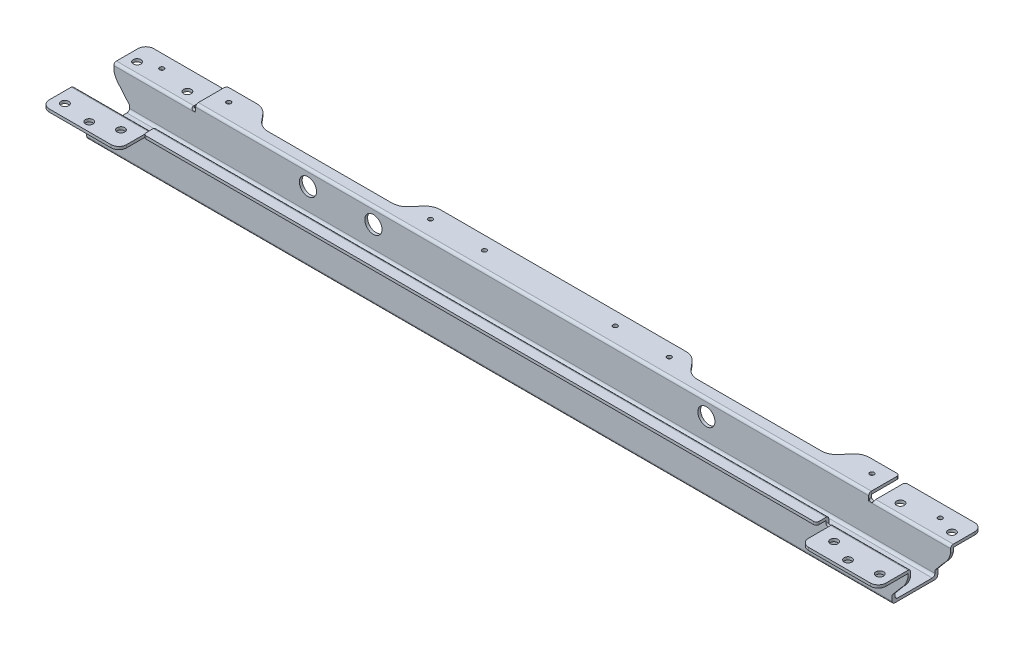
from build123d import *

# Parameters (mm, degrees)
BOSS_EXTRUDE1_DEPTH = 442.65
BOSS_EXTRUDE2_DEPTH = 25.07
SKETCH4_W           = 21.95
SKETCH4_H           = 18.71
CUT_EXTRUDE2_DEPTH  = 461.668386071
SKETCH5_R           = 4.725
CUT_EXTRUDE3_DEPTH  = 1.56
BOSS_EXTRUDE3_DEPTH = 1.56
BOSS_EXTRUDE4_DEPTH = 1.56
FILLET1_R           = 1.44
BOSS_EXTRUDE5_DEPTH = 1.56
FILLET2_R           = 1.44
SKETCH10_R          = 2.115
SKETCH10_R_2        = 1.22
CUT_EXTRUDE4_DEPTH  = 453.665622856
SKETCH11_R          = 1.22
SKETCH11_R_2        = 2.875
SKETCH11_R_3        = 3.865
CUT_EXTRUDE5_DEPTH  = 453.798104364


with BuildPart() as part:
    # Sketch1 → Boss-Extrude1 (new body)
    with BuildSketch(Plane(origin=(0, 0, 0), x_dir=(0, 0, -1), z_dir=(1, 0, 0))):
        with BuildLine():
            Line((-11.095, 0), (11.095, 0))
            ThreePointArc((11.095, 0), (12.113233765, 0.421766235), (12.535, 1.44))
            Line((12.535, 1.44), (12.535, 4.55))
            Line((12.535, 4.55), (10.975, 4.55))
            Line((10.975, 4.55), (10.975, 3))
            ThreePointArc((10.975, 3), (10.553233765, 1.981766235), (9.535, 1.56))
            Line((9.535, 1.56), (-9.535, 1.56))
            ThreePointArc((-9.535, 1.56), (-10.553233765, 1.981766235), (-10.975, 3))
            Line((-10.975, 3), (-10.975, 4.55))
            Line((-10.975, 4.55), (-12.535, 4.55))
            Line((-12.535, 4.55), (-12.535, 1.44))
            ThreePointArc((-12.535, 1.44), (-12.113233765, 0.421766235), (-11.095, 0))
        make_face()
    extrude(amount=-BOSS_EXTRUDE1_DEPTH)

    # Sketch2 → Boss-Extrude2 (add)
    with BuildSketch(Plane(origin=(0, 0, -12.535), x_dir=(-1, 0, 0), z_dir=(0, 0, -1))):
        with BuildLine():
            Line((-8.63, 20.52), (-8.63, 16.92))
            ThreePointArc((-8.63, 16.92), (-7.322682784, 13.416106263), (-4.988031851, 10.494504879))
            Line((-4.988031851, 10.494504879), (0, 4.55))
            Line((0, 4.55), (442.65, 4.55))
            Line((442.65, 4.55), (447.638031851, 10.494504879))
            ThreePointArc((447.638031851, 10.494504879), (449.972682784, 13.416106263), (451.28, 16.92))
            Line((451.28, 16.92), (451.28, 20.52))
            Line((451.28, 20.52), (442.65, 20.52))
            Line((442.65, 20.52), (408.71, 20.52))
            ThreePointArc((408.71, 20.52), (407.49, 19.3), (406.27, 20.52))
            Line((406.27, 20.52), (406.27, 23.26))
            Line((406.27, 23.26), (36.38, 23.26))
            Line((36.38, 23.26), (36.38, 20.52))
            ThreePointArc((36.38, 20.52), (35.16, 19.3), (33.94, 20.52))
            Line((33.94, 20.52), (0, 20.52))
            Line((0, 20.52), (-8.63, 20.52))
        make_face()
    extrude(amount=-BOSS_EXTRUDE2_DEPTH)

    # Sketch4 → Cut-Extrude2 (cut, through all)
    with BuildSketch(Plane.ZY.offset(451.28)):
        with Locations((0, 13.905)):
            Rectangle(SKETCH4_W, SKETCH4_H)
    extrude(amount=-CUT_EXTRUDE2_DEPTH, mode=Mode.SUBTRACT)

    # Sketch5 → Cut-Extrude3 (cut)
    with BuildSketch(Plane(origin=(0, 0, -12.535), x_dir=(-1, 0, 0), z_dir=(0, 0, -1))):
        with Locations((344.595, 14.795)):
            Circle(SKETCH5_R)
        with Locations((308.625, 14.795)):
            Circle(SKETCH5_R)
        with Locations((125.615, 14.795)):
            Circle(SKETCH5_R)
    extrude(amount=-CUT_EXTRUDE3_DEPTH, mode=Mode.SUBTRACT)

    # Sketch7 → Boss-Extrude3 (add)
    with BuildSketch(Plane(origin=(0, 20.52, 0), x_dir=(1, 0, 0), z_dir=(0, 1, 0))):
        with BuildLine():
            Line((-451.28, 12.535), (-408.71, 12.535))
            Line((-408.71, 12.535), (-408.71, 27.125))
            ThreePointArc((-408.71, 27.125), (-409.131766235, 28.143233765), (-410.15, 28.565))
            Line((-410.15, 28.565), (-446.96, 28.565))
            ThreePointArc((-446.96, 28.565), (-450.014701295, 27.299701295), (-451.28, 24.245))
            Line((-451.28, 24.245), (-451.28, 12.535))
        make_face()
        with BuildLine():
            Line((-33.94, 12.535), (-33.94, 27.125))
            ThreePointArc((-33.94, 27.125), (-33.518233765, 28.143233765), (-32.5, 28.565))
            Line((-32.5, 28.565), (4.31, 28.565))
            ThreePointArc((4.31, 28.565), (7.364701295, 27.299701295), (8.63, 24.245))
            Line((8.63, 24.245), (8.63, 12.535))
            Line((8.63, 12.535), (-33.94, 12.535))
        make_face()
    extrude(amount=-BOSS_EXTRUDE3_DEPTH)

    # Sketch8 → Boss-Extrude4 (add)
    with BuildSketch(Plane(origin=(0, 20.52, 0), x_dir=(1, 0, 0), z_dir=(0, 1, 0))):
        with BuildLine():
            Line((-33.94, -12.535), (8.63, -12.535))
            Line((8.63, -12.535), (8.63, -24.515))
            ThreePointArc((8.63, -24.515), (7.364701295, -27.569701295), (4.31, -28.835))
            Line((4.31, -28.835), (-29.62, -28.835))
            ThreePointArc((-29.62, -28.835), (-32.674701295, -27.569701295), (-33.94, -24.515))
            Line((-33.94, -24.515), (-33.94, -12.535))
        make_face()
        with BuildLine():
            Line((-408.71, -12.535), (-408.71, -24.515))
            ThreePointArc((-408.71, -24.515), (-409.975298705, -27.569701295), (-413.03, -28.835))
            Line((-413.03, -28.835), (-446.96, -28.835))
            ThreePointArc((-446.96, -28.835), (-450.014701295, -27.569701295), (-451.28, -24.515))
            Line((-451.28, -24.515), (-451.28, -12.535))
            Line((-451.28, -12.535), (-408.71, -12.535))
        make_face()
    extrude(amount=-BOSS_EXTRUDE4_DEPTH)

    # Fillet1
    # the kernel refuses this fillet: 1.44 mm, written as the material it takes off along each edge
    with BuildSketch(Plane(origin=(-454.88, 20.52, -10.975), x_dir=(0, -1, 0), z_dir=(1, 0, 0))) as fillet1_piece_1_section:
        with BuildLine():
            CenterArc((FILLET1_R, FILLET1_R), FILLET1_R, 180, 90)
            Line((0, FILLET1_R), (0, 0))
            Line((0, 0), (FILLET1_R, 0))
        make_face()
    fillet1_piece_1 = extrude(amount=49.77, mode=Mode.PRIVATE)
    fillet1_piece_1 = split(fillet1_piece_1, bisect_by=Plane(origin=(-406.27, 20.196728814, -11.295843136), z_dir=(-1, 0, 0)), keep=Keep.TOP, mode=Mode.PRIVATE)
    add(fillet1_piece_1, mode=Mode.SUBTRACT)
    with BuildSketch(Plane(origin=(-405.11, 20.52, 10.975), x_dir=(0, 0, 1), z_dir=(-1, 0, 0))) as fillet1_piece_2_section:
        with BuildLine():
            CenterArc((FILLET1_R, -FILLET1_R), FILLET1_R, 90, 90)
            Line((0, -FILLET1_R), (0, 0))
            Line((0, 0), (FILLET1_R, 0))
        make_face()
    fillet1_piece_2 = extrude(amount=49.77, mode=Mode.PRIVATE)
    fillet1_piece_2 = split(fillet1_piece_2, bisect_by=Plane(origin=(-406.27, 20.196728899, 11.295843093), z_dir=(-1, 0, 0)), keep=Keep.TOP, mode=Mode.PRIVATE)
    add(fillet1_piece_2, mode=Mode.SUBTRACT)
    with BuildSketch(Plane(origin=(-37.54, 20.52, -10.975), x_dir=(0, -1, 0), z_dir=(1, 0, 0))) as fillet1_piece_3_section:
        with BuildLine():
            CenterArc((FILLET1_R, FILLET1_R), FILLET1_R, 180, 90)
            Line((0, FILLET1_R), (0, 0))
            Line((0, 0), (FILLET1_R, 0))
        make_face()
    fillet1_piece_3 = extrude(amount=49.77, mode=Mode.PRIVATE)
    fillet1_piece_3 = split(fillet1_piece_3, bisect_by=Plane(origin=(-36.38, 20.196728881, -11.295843267), z_dir=(1, 0, 0)), keep=Keep.TOP, mode=Mode.PRIVATE)
    add(fillet1_piece_3, mode=Mode.SUBTRACT)
    with BuildSketch(Plane(origin=(12.23, 20.52, 10.975), x_dir=(0, 0, 1), z_dir=(-1, 0, 0))) as fillet1_piece_4_section:
        with BuildLine():
            CenterArc((FILLET1_R, -FILLET1_R), FILLET1_R, 90, 90)
            Line((0, -FILLET1_R), (0, 0))
            Line((0, 0), (FILLET1_R, 0))
        make_face()
    fillet1_piece_4 = extrude(amount=49.77, mode=Mode.PRIVATE)
    fillet1_piece_4 = split(fillet1_piece_4, bisect_by=Plane(origin=(-36.38, 20.196728966, 11.295843224), z_dir=(1, 0, 0)), keep=Keep.TOP, mode=Mode.PRIVATE)
    add(fillet1_piece_4, mode=Mode.SUBTRACT)

    # Sketch9 → Boss-Extrude5 (add)
    with BuildSketch(Plane(origin=(0, 23.26, 0), x_dir=(1, 0, 0), z_dir=(0, 1, 0))):
        with BuildLine():
            Line((-406.27, 12.535), (-406.27, 26.505))
            ThreePointArc((-406.27, 26.505), (-405.848233765, 27.523233765), (-404.83, 27.945))
            Line((-404.83, 27.945), (-389.858898166, 27.945))
            ThreePointArc((-389.858898166, 27.945), (-386.207476385, 27.13549928), (-383.240274178, 24.858684948))
            Line((-383.240274178, 24.858684948), (-379.911255562, 20.891315052))
            ThreePointArc((-379.911255562, 20.891315052), (-376.944053355, 18.61450072), (-373.292631573, 17.805))
            Line((-373.292631573, 17.805), (-305.28152974, 17.805))
            ThreePointArc((-305.28152974, 17.805), (-301.630107958, 18.61450072), (-298.662905751, 20.891315052))
            Line((-298.662905751, 20.891315052), (-295.333887135, 24.858684948))
            ThreePointArc((-295.333887135, 24.858684948), (-292.366684928, 27.13549928), (-288.715263147, 27.945))
            Line((-288.715263147, 27.945), (-273.744161313, 27.945))
            Line((-273.744161313, 27.945), (-168.906161313, 27.945))
            Line((-168.906161313, 27.945), (-153.93505948, 27.945))
            ThreePointArc((-153.93505948, 27.945), (-150.283637698, 27.13549928), (-147.316435491, 24.858684948))
            Line((-147.316435491, 24.858684948), (-143.987416875, 20.891315052))
            ThreePointArc((-143.987416875, 20.891315052), (-141.020214668, 18.61450072), (-137.368792887, 17.805))
            Line((-137.368792887, 17.805), (-69.357691053, 17.805))
            ThreePointArc((-69.357691053, 17.805), (-65.706269272, 18.61450072), (-62.739067065, 20.891315052))
            Line((-62.739067065, 20.891315052), (-59.410048449, 24.858684948))
            ThreePointArc((-59.410048449, 24.858684948), (-56.442846242, 27.13549928), (-52.79142446, 27.945))
            Line((-52.79142446, 27.945), (-37.820322627, 27.945))
            ThreePointArc((-37.820322627, 27.945), (-36.802088862, 27.523233765), (-36.380322627, 26.505))
            Line((-36.380322627, 26.505), (-36.380322627, 12.535))
            Line((-36.380322627, 12.535), (-406.27, 12.535))
        make_face()
        with BuildLine():
            Line((-406.27, -12.535), (-36.38, -12.535))
            Line((-36.38, -12.535), (-36.38, -16.365))
            ThreePointArc((-36.38, -16.365), (-36.801766235, -17.383233765), (-37.82, -17.805))
            Line((-37.82, -17.805), (-404.83, -17.805))
            ThreePointArc((-404.83, -17.805), (-405.848233765, -17.383233765), (-406.27, -16.365))
            Line((-406.27, -16.365), (-406.27, -12.535))
        make_face()
    extrude(amount=-BOSS_EXTRUDE5_DEPTH)

    # Fillet2
    fillet2_edges = [part.edges().sort_by_distance(p)[0] for p in [
        (-221.325, 23.26, -10.975),
        (-221.325, 23.26, 10.975),
    ]]
    fillet(fillet2_edges, radius=FILLET2_R)

    # Sketch10 → Cut-Extrude4 (cut, through all)
    with BuildSketch(Plane(origin=(0, 20.52, 0), x_dir=(1, 0, 0), z_dir=(0, 1, 0))):
        with Locations(Location((-445.255, 17.74, 0), (0, 0, 180))):
            Circle(SKETCH10_R)
        with Locations(Location((-435.24, 21.325, 0), (0, 0, 180))):
            Circle(SKETCH10_R_2)
        with Locations(Location((-417.275, 17.41, 0), (0, 0, 180))):
            Circle(SKETCH10_R)
        with Locations(Location((-25.375322627, 17.41, 0), (0, 0, 180))):
            Circle(SKETCH10_R)
        with Locations(Location((-7.410322627, 21.325, 0), (0, 0, 180))):
            Circle(SKETCH10_R_2)
        with Locations(Location((2.604677373, 17.74, 0), (0, 0, 180))):
            Circle(SKETCH10_R)
        with Locations(Location((-445.255, -21.95, 0), (0, 0, 180))):
            Circle(SKETCH10_R)
        with Locations(Location((-429.825, -23.97, 0), (0, 0, 180))):
            Circle(SKETCH10_R)
        with Locations(Location((-417.295, -19.08, 0), (0, 0, 180))):
            Circle(SKETCH10_R)
        with Locations(Location((2.604677373, -21.95, 0), (0, 0, 270))):
            Circle(SKETCH10_R)
        with Locations(Location((-12.825322627, -23.97, 0), (0, 0, 270))):
            Circle(SKETCH10_R)
        with Locations(Location((-25.355322627, -19.08, 0), (0, 0, 270))):
            Circle(SKETCH10_R)
    extrude(amount=-CUT_EXTRUDE4_DEPTH, mode=Mode.SUBTRACT)

    # Sketch11 → Cut-Extrude5 (cut, through all)
    with BuildSketch(Plane(origin=(0, 23.26, 0), x_dir=(1, 0, 0), z_dir=(0, 1, 0))):
        with Locations(Location((-398.07, 20.925, 0), (0, 0, 180))):
            Circle(SKETCH11_R)
        with Locations(Location((-286.955263143, 20.675, 0), (0, 0, 180))):
            Circle(SKETCH11_R)
        with Locations(Location((-257.275263143, 20.675, 0), (0, 0, 180))):
            Circle(SKETCH11_R)
        with Locations(Location((-44.580322627, 20.925, 0), (0, 0, 270))):
            Circle(SKETCH11_R)
        with Locations(Location((-185.375059483, 20.675, 0), (0, 0, 270))):
            Circle(SKETCH11_R)
        with Locations(Location((-155.695059483, 20.675, 0), (0, 0, 270))):
            Circle(SKETCH11_R)
        with Locations(Location((-99.485, 0, 0), (0, 0, 180))):
            Circle(SKETCH11_R_2)
        with Locations(Location((-182.065, 0, 0), (0, 0, 180))):
            Circle(SKETCH11_R_3)
        with Locations(Location((-343.165322627, 0, 0), (0, 0, 270))):
            Circle(SKETCH11_R_2)
        with Locations(Location((-260.585322627, 0, 0), (0, 0, 270))):
            Circle(SKETCH11_R_3)
    extrude(amount=-CUT_EXTRUDE5_DEPTH, mode=Mode.SUBTRACT)


solid = part.part
